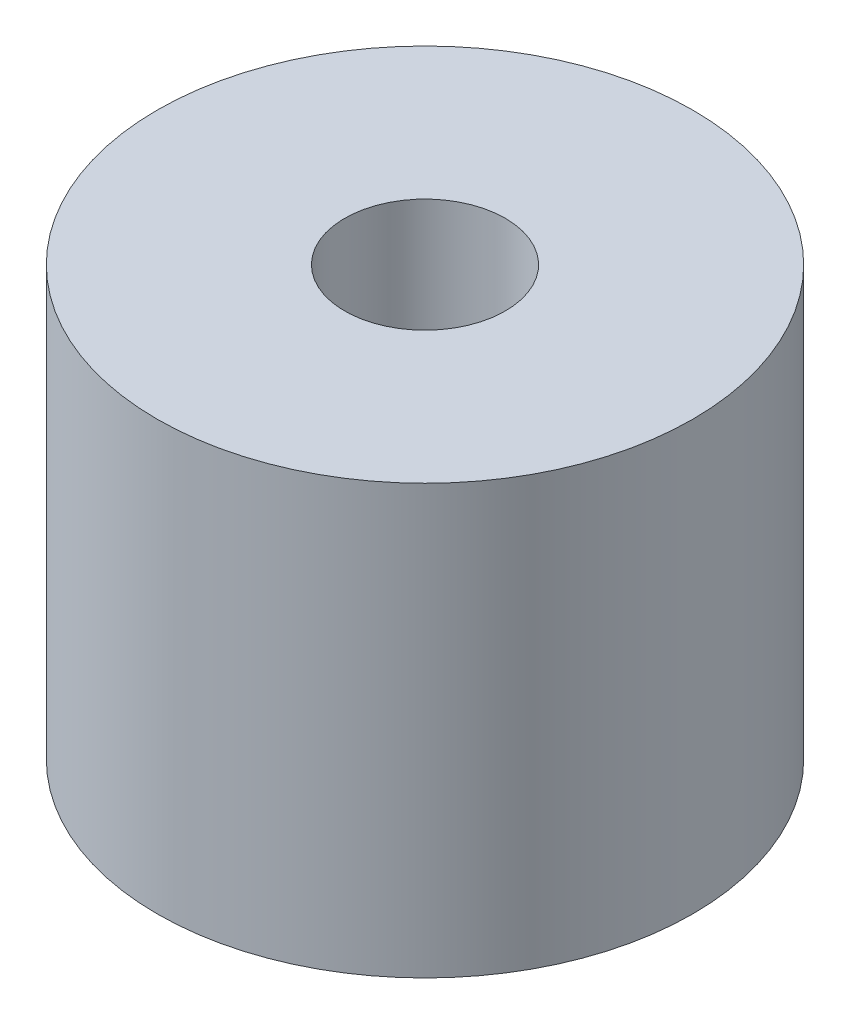
from build123d import *

# Parameters (mm, degrees)
SKETCH1_R          = 25
BASE_FLANGE1_DEPTH = 40
SKETCH8_R          = 11
CUT_EXTRUDE2_DEPTH = 5
SKETCH9_R          = 7.5
CUT_EXTRUDE3_DEPTH = 50.749371855


# Sheet-metal steps are written as plain solids
with BuildPart() as part:
    # Sketch1 → Base-Flange1 (new body)
    with BuildSketch(Plane(origin=(0, 0, 0), x_dir=(1, 0, 0), z_dir=(0, 1, 0))):
        with Locations(Location((0, 0, 0), (0, 0, 270))):
            Circle(SKETCH1_R)
    extrude(amount=-BASE_FLANGE1_DEPTH)

    # Sketch8 → Cut-Extrude2 (cut)
    with BuildSketch(Plane.XZ.offset(40)):
        with Locations(Location((0, 0, 0), (0, 0, 270))):
            Circle(SKETCH8_R)
    extrude(amount=-CUT_EXTRUDE2_DEPTH, mode=Mode.SUBTRACT)

    # Sketch9 → Cut-Extrude3 (cut, through all)
    with BuildSketch(Plane.XZ.offset(35)):
        with Locations(Location((0, 0, 0), (0, 0, 270))):
            Circle(SKETCH9_R)
    extrude(amount=-CUT_EXTRUDE3_DEPTH, mode=Mode.SUBTRACT)


solid = part.part
